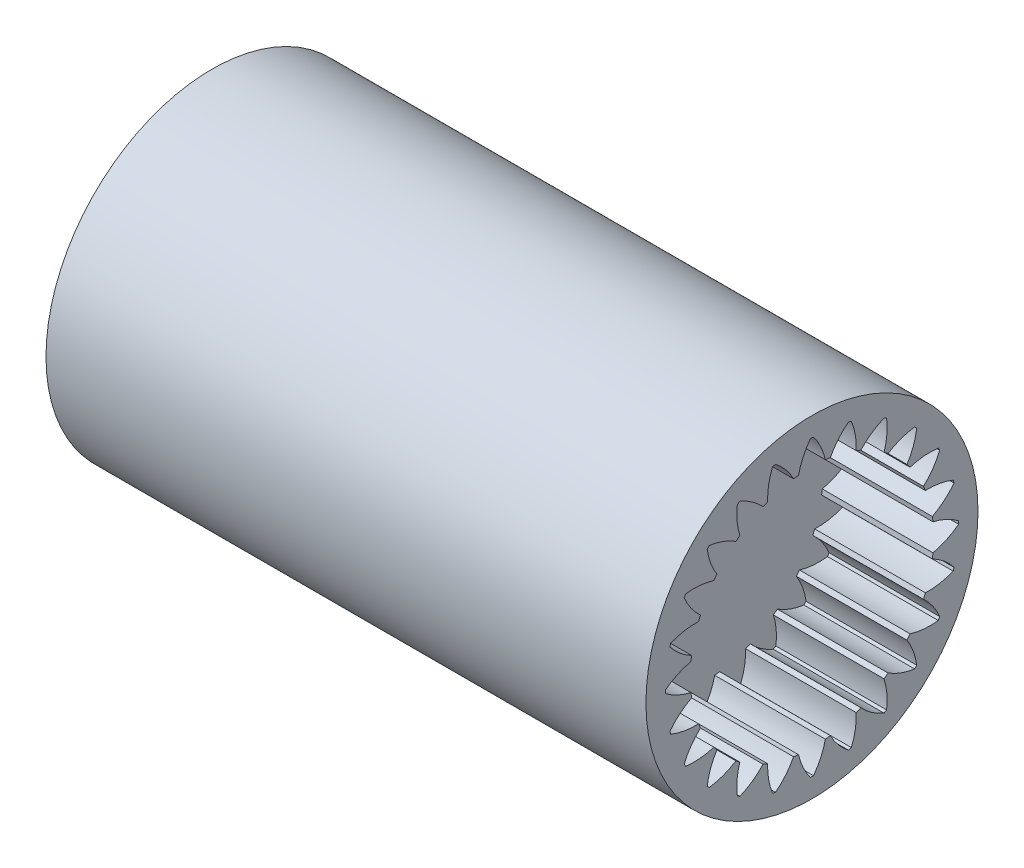
from build123d import *

# Parameters (mm, degrees)
INTERNAL_START                  = -88.407440494
INTERNAL_SPUR_GEAR_AM_OUTLINE_R = 7.5
INTERNAL_SPUR_GEAR_AM_DEPTH     = 5
BOSS_EXTRUDE2_START             = 22.1
SKETCH3_R                       = 7.5
BOSS_EXTRUDE2_DEPTH             = 22.1


# Read off the part's stored shape, not the designer's step: internal spur gear_am
with BuildPart() as part:
    # internal spur gear_am outline → internal spur gear_am (new body)
    with BuildSketch(Plane.YZ.offset(INTERNAL_START)):
        with Locations((15.590226083, 31.241752714)):
            Circle(INTERNAL_SPUR_GEAR_AM_OUTLINE_R)
        with BuildLine():
            ThreePointArc((22.215876043, 31.173645397), (21.665278496, 30.84231879), (21.056750139, 30.635852768))
            ThreePointArc((21.056750139, 30.635852768), (21.043172821, 30.523858657), (21.027301295, 30.412166585))
            ThreePointArc((21.027301295, 30.412166585), (21.561657212, 30.055236993), (22.007739967, 29.592694935))
            ThreePointArc((22.007739967, 29.592694935), (21.990450608, 29.526817722), (21.972485025, 29.461121702))
            ThreePointArc((21.972485025, 29.461121702), (21.354894998, 29.283589907), (20.713664403, 29.241657772))
            ThreePointArc((20.713664403, 29.241657772), (20.671563512, 29.136993836), (20.62732476, 29.033215432))
            ThreePointArc((20.62732476, 29.033215432), (21.051092764, 28.550146434), (21.362260924, 27.987910402))
            ThreePointArc((21.362260924, 27.987910402), (21.328510409, 27.928752714), (21.294153607, 27.869945067))
            ThreePointArc((21.294153607, 27.869945067), (20.65165884, 27.858306583), (20.021424813, 27.98376594))
            ThreePointArc((20.021424813, 27.98376594), (19.953669455, 27.893564855), (19.884078274, 27.804772446))
            ThreePointArc((19.884078274, 27.804772446), (20.168379277, 27.228484394), (20.323427246, 26.604869844))
            ThreePointArc((20.323427246, 26.604869844), (20.275515615, 26.556463182), (20.227108954, 26.508551552))
            ThreePointArc((20.227108954, 26.508551552), (19.603494404, 26.663599521), (19.027206352, 26.947900524))
            ThreePointArc((19.027206352, 26.947900524), (18.938413943, 26.878309343), (18.848212857, 26.810553985))
            ThreePointArc((18.848212857, 26.810553985), (18.973672215, 26.180319958), (18.96203373, 25.537825191))
            ThreePointArc((18.96203373, 25.537825191), (18.903226083, 25.503468389), (18.844068396, 25.469717874))
            ThreePointArc((18.844068396, 25.469717874), (18.281832364, 25.780886034), (17.798763365, 26.204654038))
            ThreePointArc((17.798763365, 26.204654038), (17.694984961, 26.160415286), (17.590321026, 26.118314394))
            ThreePointArc((17.590321026, 26.118314394), (17.548388891, 25.4770838), (17.370857096, 24.859493773))
            ThreePointArc((17.370857096, 24.859493773), (17.305161076, 24.841528189), (17.239283862, 24.824238831))
            ThreePointArc((17.239283862, 24.824238831), (16.776741804, 25.270321586), (16.419812213, 25.804677503))
            ThreePointArc((16.419812213, 25.804677503), (16.308120141, 25.788805977), (16.19612603, 25.775228658))
            ThreePointArc((16.19612603, 25.775228658), (15.989660007, 25.166700302), (15.658333401, 24.616102754))
            ThreePointArc((15.658333401, 24.616102754), (15.590226083, 24.615752714), (15.522118766, 24.616102754))
            ThreePointArc((15.522118766, 24.616102754), (15.190792159, 25.166700301), (14.984326137, 25.775228658))
            ThreePointArc((14.984326137, 25.775228658), (14.872332026, 25.788805977), (14.760639954, 25.804677503))
            ThreePointArc((14.760639954, 25.804677503), (14.403710362, 25.270321586), (13.941168304, 24.824238831))
            ThreePointArc((13.941168304, 24.824238831), (13.87529109, 24.841528189), (13.809595071, 24.859493773))
            ThreePointArc((13.809595071, 24.859493773), (13.632063276, 25.4770838), (13.59013114, 26.118314394))
            ThreePointArc((13.59013114, 26.118314394), (13.485467205, 26.160415286), (13.381688801, 26.204654038))
            ThreePointArc((13.381688801, 26.204654038), (12.898619802, 25.780886034), (12.33638377, 25.469717874))
            ThreePointArc((12.33638377, 25.469717874), (12.277226083, 25.503468389), (12.218418436, 25.537825191))
            ThreePointArc((12.218418436, 25.537825191), (12.206779952, 26.180319958), (12.332239309, 26.810553985))
            ThreePointArc((12.332239309, 26.810553985), (12.242038224, 26.878309343), (12.153245815, 26.947900524))
            ThreePointArc((12.153245815, 26.947900524), (11.576957763, 26.663599521), (10.953343213, 26.508551552))
            ThreePointArc((10.953343213, 26.508551552), (10.904936551, 26.556463182), (10.857024921, 26.604869844))
            ThreePointArc((10.857024921, 26.604869844), (11.01207289, 27.228484394), (11.296373893, 27.804772446))
            ThreePointArc((11.296373893, 27.804772446), (11.226782712, 27.893564855), (11.159027354, 27.98376594))
            ThreePointArc((11.159027354, 27.98376594), (10.528793327, 27.858306583), (9.88629856, 27.869945067))
            ThreePointArc((9.88629856, 27.869945067), (9.851941758, 27.928752714), (9.818191243, 27.987910402))
            ThreePointArc((9.818191243, 27.987910402), (10.129359403, 28.550146434), (10.553127407, 29.033215432))
            ThreePointArc((10.553127407, 29.033215432), (10.508888654, 29.136993836), (10.466787763, 29.241657772))
            ThreePointArc((10.466787763, 29.241657772), (9.825557169, 29.283589907), (9.207967142, 29.461121702))
            ThreePointArc((9.207967142, 29.461121702), (9.190001558, 29.526817721), (9.1727122, 29.592694935))
            ThreePointArc((9.1727122, 29.592694935), (9.618794955, 30.055236993), (10.153150872, 30.412166585))
            ThreePointArc((10.153150872, 30.412166585), (10.137279346, 30.523858657), (10.123702027, 30.635852768))
            ThreePointArc((10.123702027, 30.635852768), (9.51517367, 30.84231879), (8.964576123, 31.173645397))
            ThreePointArc((8.964576123, 31.173645397), (8.964226083, 31.241752715), (8.964576123, 31.309860032))
            ThreePointArc((8.964576123, 31.309860032), (9.51517367, 31.641186639), (10.123702027, 31.847652661))
            ThreePointArc((10.123702027, 31.847652661), (10.137279346, 31.959646772), (10.153150872, 32.071338844))
            ThreePointArc((10.153150872, 32.071338844), (9.618794955, 32.428268436), (9.1727122, 32.890810493))
            ThreePointArc((9.1727122, 32.890810493), (9.190001558, 32.956687707), (9.207967142, 33.022383727))
            ThreePointArc((9.207967142, 33.022383727), (9.825557169, 33.199915522), (10.466787763, 33.241847657))
            ThreePointArc((10.466787763, 33.241847657), (10.508888654, 33.346511592), (10.553127407, 33.450289996))
            ThreePointArc((10.553127407, 33.450289996), (10.129359403, 33.933358995), (9.818191243, 34.495595027))
            ThreePointArc((9.818191243, 34.495595027), (9.851941758, 34.554752714), (9.88629856, 34.613560362))
            ThreePointArc((9.88629856, 34.613560362), (10.528793327, 34.625198846), (11.159027354, 34.499739488))
            ThreePointArc((11.159027354, 34.499739488), (11.226782712, 34.589940574), (11.296373893, 34.678732983))
            ThreePointArc((11.296373893, 34.678732983), (11.01207289, 35.255021035), (10.857024921, 35.878635585))
            ThreePointArc((10.857024921, 35.878635585), (10.904936551, 35.927042247), (10.953343213, 35.974953877))
            ThreePointArc((10.953343213, 35.974953877), (11.576957763, 35.819905908), (12.153245815, 35.535604905))
            ThreePointArc((12.153245815, 35.535604905), (12.242038224, 35.605196086), (12.332239309, 35.672951444))
            ThreePointArc((12.332239309, 35.672951444), (12.206779952, 36.303185471), (12.218418436, 36.945680238))
            ThreePointArc((12.218418436, 36.945680238), (12.277226083, 36.98003704), (12.33638377, 37.013787555))
            ThreePointArc((12.33638377, 37.013787555), (12.898619802, 36.702619395), (13.381688801, 36.278851391))
            ThreePointArc((13.381688801, 36.278851391), (13.485467205, 36.323090143), (13.59013114, 36.365191035))
            ThreePointArc((13.59013114, 36.365191035), (13.632063276, 37.006421629), (13.809595071, 37.624011656))
            ThreePointArc((13.809595071, 37.624011656), (13.875291091, 37.641977239), (13.941168304, 37.659266598))
            ThreePointArc((13.941168304, 37.659266598), (14.403710362, 37.213183843), (14.760639954, 36.678827926))
            ThreePointArc((14.760639954, 36.678827926), (14.872332026, 36.694699452), (14.984326137, 36.70827677))
            ThreePointArc((14.984326137, 36.70827677), (15.190792159, 37.316805127), (15.522118766, 37.867402675))
            ThreePointArc((15.522118766, 37.867402675), (15.590226084, 37.867752714), (15.658333401, 37.867402675))
            ThreePointArc((15.658333401, 37.867402675), (15.989660007, 37.316805127), (16.19612603, 36.70827677))
            ThreePointArc((16.19612603, 36.70827677), (16.308120141, 36.694699452), (16.419812213, 36.678827926))
            ThreePointArc((16.419812213, 36.678827926), (16.776741804, 37.213183843), (17.239283862, 37.659266598))
            ThreePointArc((17.239283862, 37.659266598), (17.305161076, 37.641977239), (17.370857096, 37.624011656))
            ThreePointArc((17.370857096, 37.624011656), (17.548388891, 37.006421629), (17.590321026, 36.365191035))
            ThreePointArc((17.590321026, 36.365191035), (17.694984961, 36.323090143), (17.798763365, 36.278851391))
            ThreePointArc((17.798763365, 36.278851391), (18.281832364, 36.702619395), (18.844068396, 37.013787555))
            ThreePointArc((18.844068396, 37.013787555), (18.903226083, 36.98003704), (18.96203373, 36.945680238))
            ThreePointArc((18.96203373, 36.945680238), (18.973672215, 36.303185471), (18.848212857, 35.672951444))
            ThreePointArc((18.848212857, 35.672951444), (18.938413943, 35.605196086), (19.027206352, 35.535604905))
            ThreePointArc((19.027206352, 35.535604905), (19.603494404, 35.819905908), (20.227108954, 35.974953877))
            ThreePointArc((20.227108954, 35.974953877), (20.275515616, 35.927042247), (20.323427246, 35.878635585))
            ThreePointArc((20.323427246, 35.878635585), (20.168379277, 35.255021035), (19.884078274, 34.678732983))
            ThreePointArc((19.884078274, 34.678732983), (19.953669455, 34.589940574), (20.021424813, 34.499739488))
            ThreePointArc((20.021424813, 34.499739488), (20.65165884, 34.625198846), (21.294153607, 34.613560362))
            ThreePointArc((21.294153607, 34.613560362), (21.328510409, 34.554752714), (21.362260924, 34.495595027))
            ThreePointArc((21.362260924, 34.495595027), (21.051092764, 33.933358995), (20.62732476, 33.450289996))
            ThreePointArc((20.62732476, 33.450289996), (20.671563512, 33.346511592), (20.713664403, 33.241847657))
            ThreePointArc((20.713664403, 33.241847657), (21.354894998, 33.199915522), (21.972485025, 33.022383727))
            ThreePointArc((21.972485025, 33.022383727), (21.990450608, 32.956687707), (22.007739967, 32.890810493))
            ThreePointArc((22.007739967, 32.890810493), (21.561657212, 32.428268436), (21.027301295, 32.071338844))
            ThreePointArc((21.027301295, 32.071338844), (21.043172821, 31.959646772), (21.056750139, 31.847652661))
            ThreePointArc((21.056750139, 31.847652661), (21.665278496, 31.641186639), (22.215876043, 31.309860032))
            ThreePointArc((22.215876043, 31.309860032), (22.216226083, 31.241752714), (22.215876043, 31.173645397))
        make_face(mode=Mode.SUBTRACT)
    extrude(amount=INTERNAL_SPUR_GEAR_AM_DEPTH)

    # Sketch3 → Boss-Extrude2 (add)
    with BuildSketch(Plane.ZY.offset(88.407440494).offset(BOSS_EXTRUDE2_START)):
        with Locations((31.241752714, 15.590226083)):
            Circle(SKETCH3_R)
    extrude(amount=-BOSS_EXTRUDE2_DEPTH)


solid = part.part
